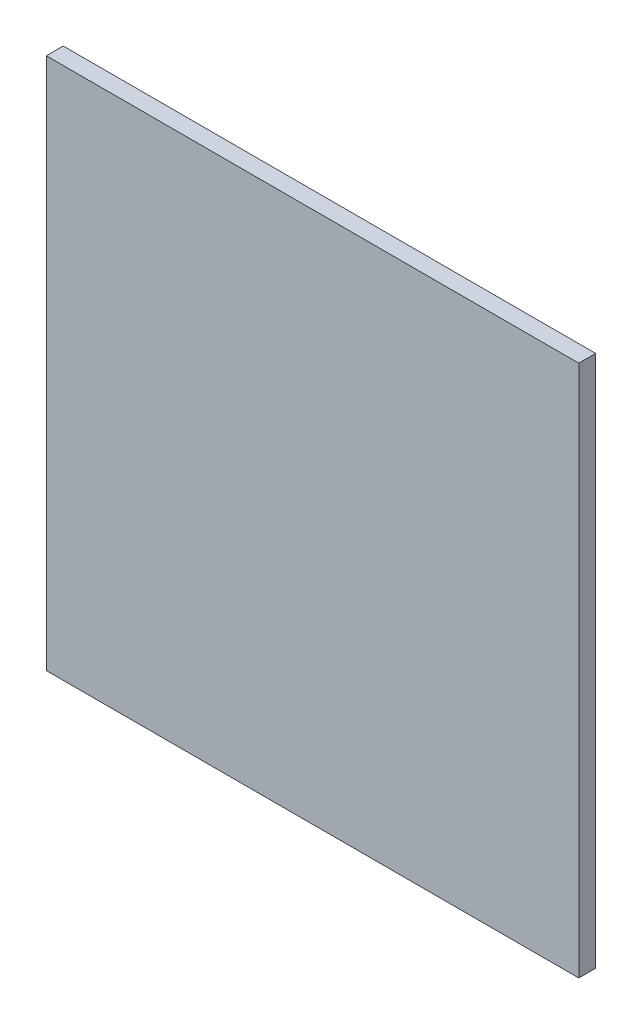
from build123d import *

# Parameters (mm, degrees)
SKETCH1_W           = 600
SKETCH1_H           = 600
BOSS_EXTRUDE1_DEPTH = 19.05


with BuildPart() as part:
    # Sketch1 → Boss-Extrude1 (new body)
    with BuildSketch(Plane.XY):
        Rectangle(SKETCH1_W, SKETCH1_H)
    extrude(amount=BOSS_EXTRUDE1_DEPTH)


solid = part.part
